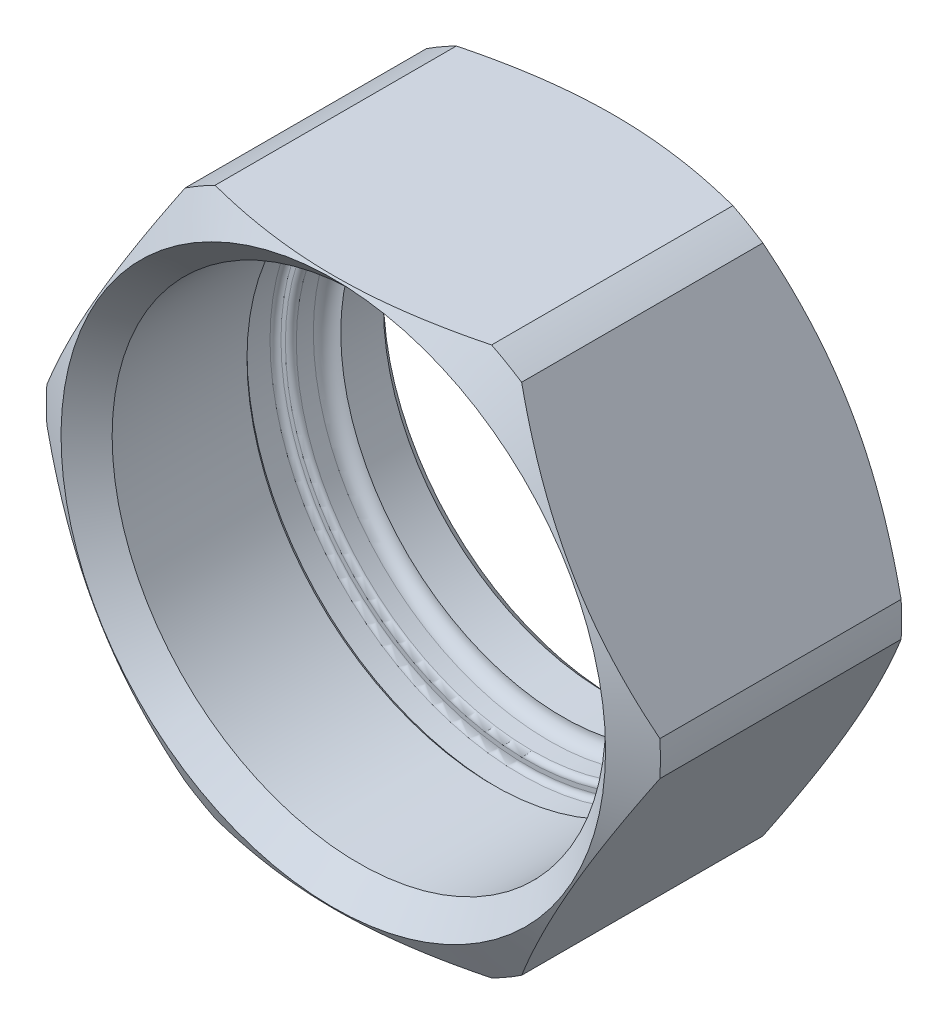
from build123d import *

# Parameters (mm, degrees)
EXTRUDE_1_DEPTH     = 26
FILLET_1_R          = 1.25
SKETCH_17_R         = 22.5
SKETCH_17_R_2       = 21.415
EXTRUDE_2_DEPTH     = 1.5
CHAMFER_1_SIZE      = 1.5
SKETCH_18_R         = 28.867513459
CUT_EXTRUDE_2_DEPTH = 47.198845585
FILLET_2_R          = 0.5
CHAMFER_2_SIZE      = 1
SKETCH_19_OUTSIDE_W = 75.872
SKETCH_19_OUTSIDE_H = 68.136
SKETCH_19_OUTSIDE_R = 28
CUT_EXTRUDE_4_DEPTH = 47.198845585
CHAMFER_3_SIZE      = 2.5


# Some blends are built 0.0001 mm under size
with BuildPart() as part:
    # Эскиз1 → Бобышка-Вытянуть1 (new body)
    with BuildSketch(Plane.XY):
        Polygon((28.867513459, 0), (14.43375673, 25), (-14.43375673, 25), (-28.867513459, 0), (-14.43375673, -25), (14.43375673, -25), align=None)
    extrude(amount=-EXTRUDE_1_DEPTH)

    # Sketch 4 → Вырез-Повернуть1 (revolve, cut)
    with BuildSketch(Plane(origin=(0, 0, 0), x_dir=(1, 0, 0), z_dir=(0, 1, 0)), mode=Mode.PRIVATE) as cut_revolve_1_sk:
        Polygon((-28.867513459, 26), (-28.867513459, 23.5), (-24.537386441, 26), align=None)
        Polygon((-28.867513459, 0), (-28.867513459, 2.5), (-24.537386441, 0), align=None)
    revolve(cut_revolve_1_sk.sketch.rotate(Axis((0, 0, 0), (0, 0, -1)), 180.000000003), axis=Axis((0, 0, 0), (0, 0, -1)), mode=Mode.SUBTRACT)

    # Эскиз5 → Вырез-Повернуть2 (revolve, cut)
    with BuildSketch(Plane(origin=(0, 0, 0), x_dir=(1, 0, 0), z_dir=(0, 1, 0))):
        Polygon((0, 0), (-22.5, 0), (-22.5, 14.8), (-22.9, 15.2), (-22.9, 17.8), (-21.5, 17.8), (-21.5, 21.1), (-20.25, 21.1), (-20.25, 26), (0, 26), align=None)
    revolve(axis=Axis((0, 0, -26), (0, 0, 1)), mode=Mode.SUBTRACT)

    # Скругление1
    fillet_1_edges = [part.edges().sort_by_distance(p)[0] for p in [
        (21.5, 0, -21.1),
    ]]
    fillet(fillet_1_edges, radius=FILLET_1_R - 0.0001)  # a hair under: the kernel refuses the full size

    # Скругление2
    fillet_2_edges = [part.edges().sort_by_distance(p)[0] for p in [
        (22.9, 0, -17.8),
        (21.5, 0, -17.8),
    ]]
    fillet(fillet_2_edges, radius=FILLET_2_R)

    # Фаска2
    chamfer_2_edges = [part.edges().sort_by_distance(p)[0] for p in [
        (20.25, 0, -26),
    ]]
    chamfer(chamfer_2_edges, length=CHAMFER_2_SIZE)

    # Эскиз19 outside → Вырез-Вытянуть4 (cut, through all)
    with BuildSketch(Plane(origin=(0, 0, -26), x_dir=(-1, 0, 0), z_dir=(0, 0, -1))):
        Rectangle(SKETCH_19_OUTSIDE_W, SKETCH_19_OUTSIDE_H)
        Circle(SKETCH_19_OUTSIDE_R, mode=Mode.SUBTRACT)
    extrude(amount=-CUT_EXTRUDE_4_DEPTH, mode=Mode.SUBTRACT)

    # Фаска3
    # the kernel refuses this chamfer: 2.5 mm, written as the material it takes off along each edge
    with BuildSketch(Plane(origin=(0, 0, 0), x_dir=(-1, 0, 0), z_dir=(0, 1, 0))) as chamfer_3_piece_1:
        Polygon((22.5, -CHAMFER_3_SIZE), (22.5 + CHAMFER_3_SIZE, 0), (22.5, 0), align=None)
    revolve(axis=Axis((0, 0, 0), (0, 0, 1)), mode=Mode.SUBTRACT)


with BuildPart() as body_2:
    # Эскиз17 → Бобышка-Вытянуть2 (new body)
    with BuildSketch(Plane.XY):
        with Locations(Location((0, 0, 0), (0, 0, 180))):
            Circle(SKETCH_17_R)
        Circle(SKETCH_17_R_2, mode=Mode.SUBTRACT)
    extrude(amount=EXTRUDE_2_DEPTH)

    # Фаска1
    # the kernel refuses this chamfer: 1.5 mm, written as the material it takes off along each edge
    with BuildSketch(Plane(origin=(0, 0, 1.5), x_dir=(1, 0, 0), z_dir=(0, -1, 0))) as chamfer_1_piece_1:
        Polygon((21.415, -CHAMFER_1_SIZE), (21.415 + CHAMFER_1_SIZE, 0), (21.415, 0), align=None)
    revolve(axis=Axis((0, 0, 1.5), (0, 0, 1)), mode=Mode.SUBTRACT)

    # Эскиз18 → Вырез-Вытянуть2 (cut, through all)
    with BuildSketch(Plane.XY):
        Circle(SKETCH_18_R)
    extrude(amount=CUT_EXTRUDE_2_DEPTH, mode=Mode.SUBTRACT)


solid = part.part
